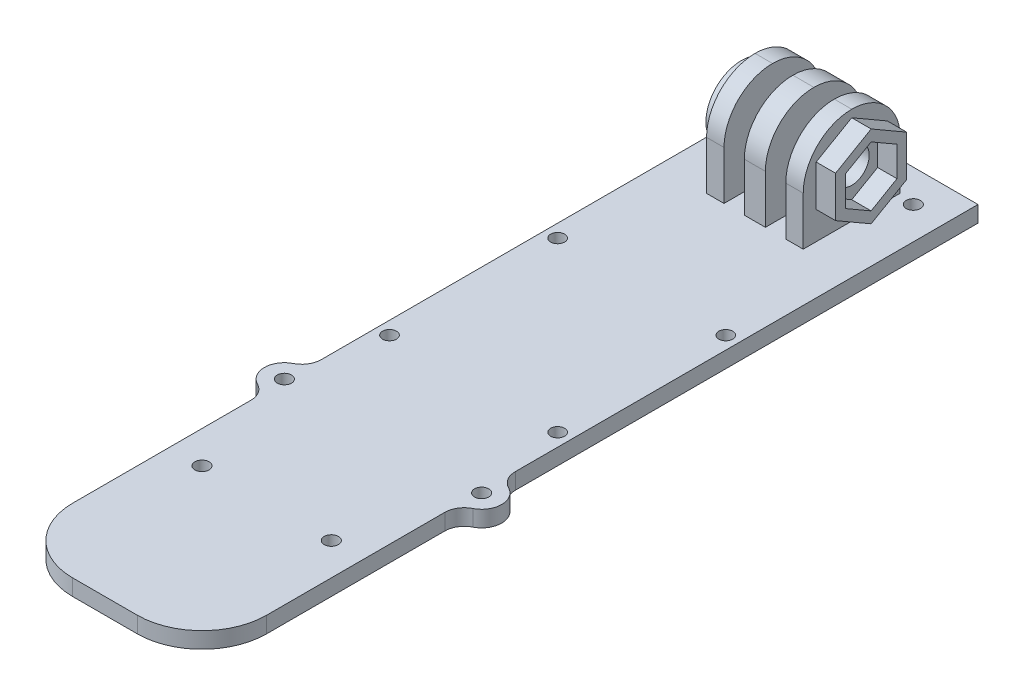
from build123d import *

# Parameters (mm, degrees)
SKETCH29_R              = 1.1
SKETCH29_R_2            = 1.075
BOSS_EXTRUDE19_DEPTH    = 2.5
SKETCH31_R              = 1.1
CUT_EXTRUDE2_DEPTH      = 2.5
SKETCH15_W              = 3.25
SKETCH15_H              = 15
SKETCH15_W_2            = 2.7
BOSS_EXTRUDE11_DEPTH    = 15
FILLET10_R              = 7.5
CUT_EXTRUDE1_DEPTH      = 12
CUT_EXTRUDE1_DEPTH_BACK = 17
SKETCH16_R              = 2.7
BOSS_EXTRUDE12_START    = 2.1
SKETCH17_R              = 5.5
SKETCH17_R_2            = 2.7
BOSS_EXTRUDE12_DEPTH    = 2.1
BOSS_EXTRUDE17_DEPTH    = 3
FILLET11_R              = 3
FILLET12_R              = 10


with BuildPart() as part:
    # Sketch29 → Boss-Extrude19 (new body)
    with BuildSketch(Plane(origin=(0, 0, 0), x_dir=(1, 0, 0), z_dir=(0, 1, 0))):
        with BuildLine():
            Line((-15, -70), (15, -70))
            Line((15, -70), (15, -30.089902911))
            ThreePointArc((15, -30.089902911), (18.35, -27), (15, -23.910097089))
            Line((15, -23.910097089), (15, 50))
            Line((15, 50), (-15, 50))
            Line((-15, 50), (-15, -23.910097089))
            ThreePointArc((-15, -23.910097089), (-18.35, -27), (-15, -30.089902911))
            Line((-15, -30.089902911), (-15, -70))
        make_face()
        with Locations(Location((-15.25, -27, 0), (0, 0, 270))):
            Circle(SKETCH29_R, mode=Mode.SUBTRACT)
        with Locations(Location((-13, 13, 0), (0, 0, 270))):
            Circle(SKETCH29_R_2, mode=Mode.SUBTRACT)
        with Locations(Location((13, 13, 0), (0, 0, 270))):
            Circle(SKETCH29_R_2, mode=Mode.SUBTRACT)
        with Locations(Location((13, -13, 0), (0, 0, 270))):
            Circle(SKETCH29_R_2, mode=Mode.SUBTRACT)
        with Locations(Location((-13, -13, 0), (0, 0, 270))):
            Circle(SKETCH29_R_2, mode=Mode.SUBTRACT)
        with Locations(Location((15.25, -27, 0), (0, 0, 270))):
            Circle(SKETCH29_R, mode=Mode.SUBTRACT)
    extrude(amount=BOSS_EXTRUDE19_DEPTH)

    # Sketch31 → Cut-Extrude2 (cut)
    with BuildSketch(Plane(origin=(0, 2.5, 0), x_dir=(1, 0, 0), z_dir=(0, 1, 0))):
        with Locations(Location((-10, -45, 0), (0, 0, 270))):
            Circle(SKETCH31_R)
        with Locations(Location((10, -45, 0), (0, 0, 270))):
            Circle(SKETCH31_R)
        with Locations(Location((-10, 45, 0), (0, 0, 270))):
            Circle(SKETCH31_R)
        with Locations(Location((10, 45, 0), (0, 0, 270))):
            Circle(SKETCH31_R)
    extrude(amount=-CUT_EXTRUDE2_DEPTH, mode=Mode.SUBTRACT)

    # Sketch15 → Boss-Extrude11 (add)
    with BuildSketch(Plane(origin=(0, 2.5, 0), x_dir=(1, 0, 0), z_dir=(0, 1, 0))):
        with Locations((0, 38)):
            Rectangle(SKETCH15_W, SKETCH15_H)
        with Locations((-6.125, 38)):
            Rectangle(SKETCH15_W_2, SKETCH15_H)
        with Locations((6.125, 38)):
            Rectangle(SKETCH15_W_2, SKETCH15_H)
    extrude(amount=BOSS_EXTRUDE11_DEPTH)

    # Fillet10
    fillet10_edges = [part.edges().sort_by_distance(p)[0] for p in [
        (6.125, 17.5, -30.5),
        (6.125, 17.5, -45.5),
        (0, 17.5, -30.5),
        (0, 17.5, -45.5),
        (-6.125, 17.5, -30.5),
        (-6.125, 17.5, -45.5),
    ]]
    fillet(fillet10_edges, radius=FILLET10_R - 0.0001)  # a hair under: the kernel refuses the full size

    # Sketch16 → Cut-Extrude1 (cut, two sides: drawn at the far end of the back side and taken through both)
    with BuildSketch(Plane.ZY.offset(7.475).offset(-CUT_EXTRUDE1_DEPTH_BACK)):
        with Locations(Location((-38, 10, 0), (0, 0, 180))):
            Circle(SKETCH16_R)
    extrude(amount=CUT_EXTRUDE1_DEPTH + CUT_EXTRUDE1_DEPTH_BACK, mode=Mode.SUBTRACT)

    # Sketch17 → Boss-Extrude12 (add)
    with BuildSketch(Plane.ZY.offset(7.475).offset(BOSS_EXTRUDE12_START)):
        with Locations(Location((-38, 10, 0), (0, 0, 180))):
            Circle(SKETCH17_R)
        with Locations(Location((-38, 10, 0), (0, 0, 180))):
            Circle(SKETCH17_R_2, mode=Mode.SUBTRACT)
    extrude(amount=-BOSS_EXTRUDE12_DEPTH)

    # Sketch23 → Boss-Extrude17 (add)
    with BuildSketch(Plane(origin=(7.475, 0, 0), x_dir=(0, 0, -1), z_dir=(1, 0, 0))):
        Polygon((38, 16.350852961), (32.5, 13.175426481), (32.5, 6.824573519), (38, 3.649147039), (43.5, 6.824573519), (43.5, 13.175426481), align=None)
        Polygon((38, 14.618802154), (34, 12.309401077), (34, 7.690598923), (38, 5.381197846), (42, 7.690598923), (42, 12.309401077), align=None, mode=Mode.SUBTRACT)
    extrude(amount=BOSS_EXTRUDE17_DEPTH)

    # Fillet11
    fillet11_edges = [part.edges().sort_by_distance(p)[0] for p in [
        (15, 1.25, 23.910097089),
        (15, 1.25, 30.089902911),
        (-15, 1.25, 30.089902911),
        (-15, 1.25, 23.910097089),
    ]]
    fillet(fillet11_edges, radius=FILLET11_R)

    # Fillet12
    fillet12_edges = [part.edges().sort_by_distance(p)[0] for p in [
        (15, 1.25, 70),
        (-15, 1.25, 70),
    ]]
    fillet(fillet12_edges, radius=FILLET12_R)


solid = part.part
